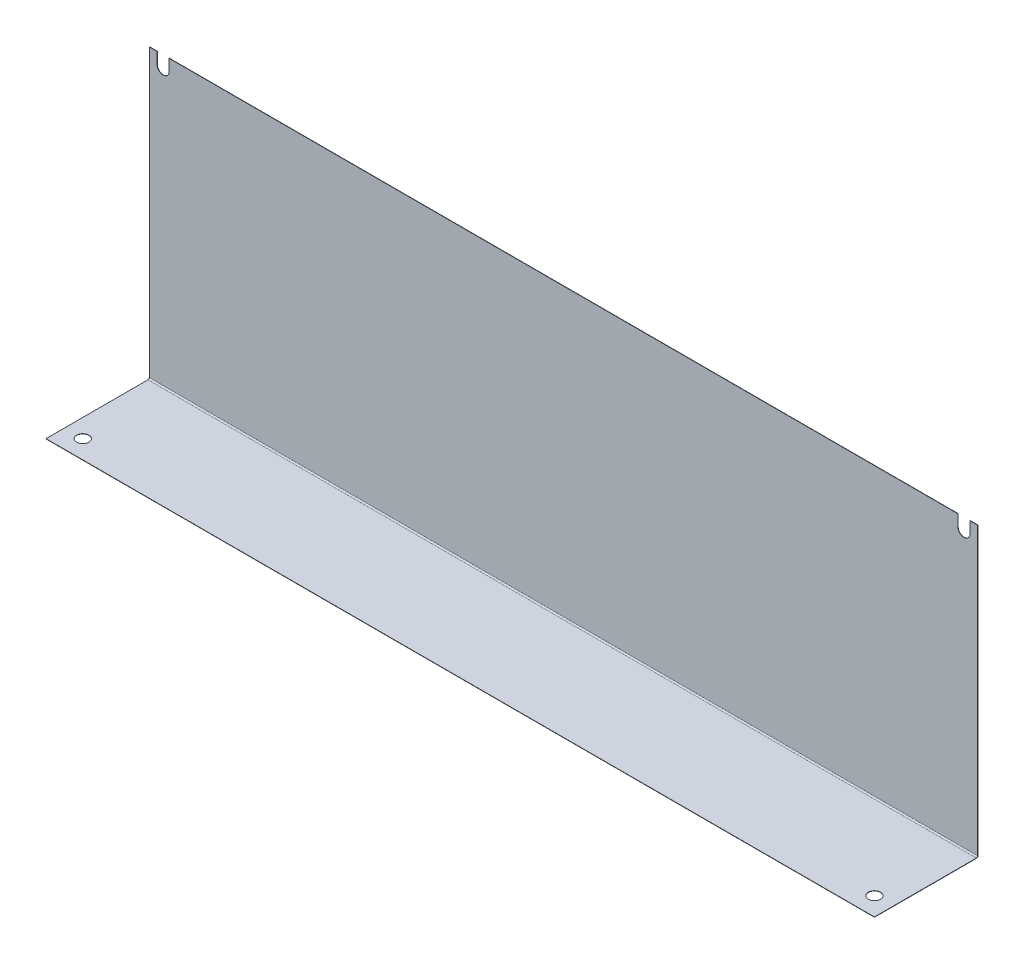
from build123d import *

# Parameters (mm, degrees)
SKETCH1_W                    = 457.2
SKETCH1_H                    = 57.15
BASE_FLANGE1_DEPTH           = 0.15875
EDGE_FLANGE1_STRIP_W         = 2.1082
EDGE_FLANGE1_STRIP_H         = 0.15875
EDGE_FLANGE1_STRIP_CUT_DEPTH = 457.2
EDGE_FLANGE1_DEPTH           = 457.2
CUT_EXTRUDE1_DEPTH           = 488.3392299
F_1_4_CLEARANCE_HOLE2_D      = 6.7564
F_1_4_CLEARANCE_HOLE2_DEPTH  = 25.4
F_1_4_CLEARANCE_HOLE2_TIP    = 2.029827343


# Sheet-metal steps are written as plain solids
with BuildPart() as part:
    # Sketch1 → Base-Flange1 (new body)
    with BuildSketch(Plane(origin=(0, 0, 0), x_dir=(1, 0, 0), z_dir=(0, 1, 0))):
        with Locations((228.6, 28.575)):
            Rectangle(SKETCH1_W, SKETCH1_H)
    extrude(amount=-BASE_FLANGE1_DEPTH)

    # Edge-Flange1 strip (across the edge) → Edge-Flange1 strip cut (cut)
    with BuildSketch(Plane(origin=(457.2, 0, -57.15), x_dir=(0, 0, 1), z_dir=(-1, 0, 0))):
        with Locations((-0.15875, -0.079375)):
            Rectangle(EDGE_FLANGE1_STRIP_W, EDGE_FLANGE1_STRIP_H)
    extrude(amount=EDGE_FLANGE1_STRIP_CUT_DEPTH, mode=Mode.SUBTRACT)

    # Edge-Flange1 section (across the edge) → Edge-Flange1 (add)
    with BuildSketch(Plane(origin=(457.2, 0, -57.15), x_dir=(0, 0, 1), z_dir=(-1, 0, 0))):
        with BuildLine():
            Line((0, 0.7366), (0, 158.75))
            Line((0, 158.75), (0.15875, 158.75))
            Line((0.15875, 158.75), (0.15875, 0.7366))
            ThreePointArc((0.15875, 0.7366), (0.374495145, 0.215745145), (0.89535, 0))
            Line((0.89535, 0), (0.89535, -0.15875))
            ThreePointArc((0.89535, -0.15875), (0.262241943, 0.103491943), (0, 0.7366))
        make_face()
    extrude(amount=EDGE_FLANGE1_DEPTH)

    # Sketch9 → Cut-Extrude1 (cut, through all)
    with BuildSketch(Plane(origin=(0, 0, -57.15), x_dir=(-1, 0, 0), z_dir=(0, 0, -1))):
        with BuildLine():
            Line((-446.278, 152.4), (-446.278, 158.75))
            Line((-446.278, 158.75), (-452.882, 158.75))
            Line((-452.882, 158.75), (-452.882, 152.4))
            ThreePointArc((-452.882, 152.4), (-449.58, 149.098), (-446.278, 152.4))
        make_face()
        with BuildLine():
            Line((-10.922, 152.4), (-10.922, 158.75))
            Line((-10.922, 158.75), (-4.318, 158.75))
            Line((-4.318, 158.75), (-4.318, 152.4))
            ThreePointArc((-4.318, 152.4), (-7.62, 149.098), (-10.922, 152.4))
        make_face()
    extrude(amount=-CUT_EXTRUDE1_DEPTH, mode=Mode.SUBTRACT)

    # 1/4 Clearance Hole2
    with Locations(Plane(origin=(10.16, -0.15875, -10.16), x_dir=(0, 0, -1), z_dir=(0, -1, 0))):
        with Locations((0, 0), (0, 436.88)):
            Hole(F_1_4_CLEARANCE_HOLE2_D / 2, depth=F_1_4_CLEARANCE_HOLE2_DEPTH)
            with Locations((0, 0, -(F_1_4_CLEARANCE_HOLE2_DEPTH + F_1_4_CLEARANCE_HOLE2_TIP / 2))):  # 118° drill point
                Cone(0, F_1_4_CLEARANCE_HOLE2_D / 2, F_1_4_CLEARANCE_HOLE2_TIP, mode=Mode.SUBTRACT)


solid = part.part
